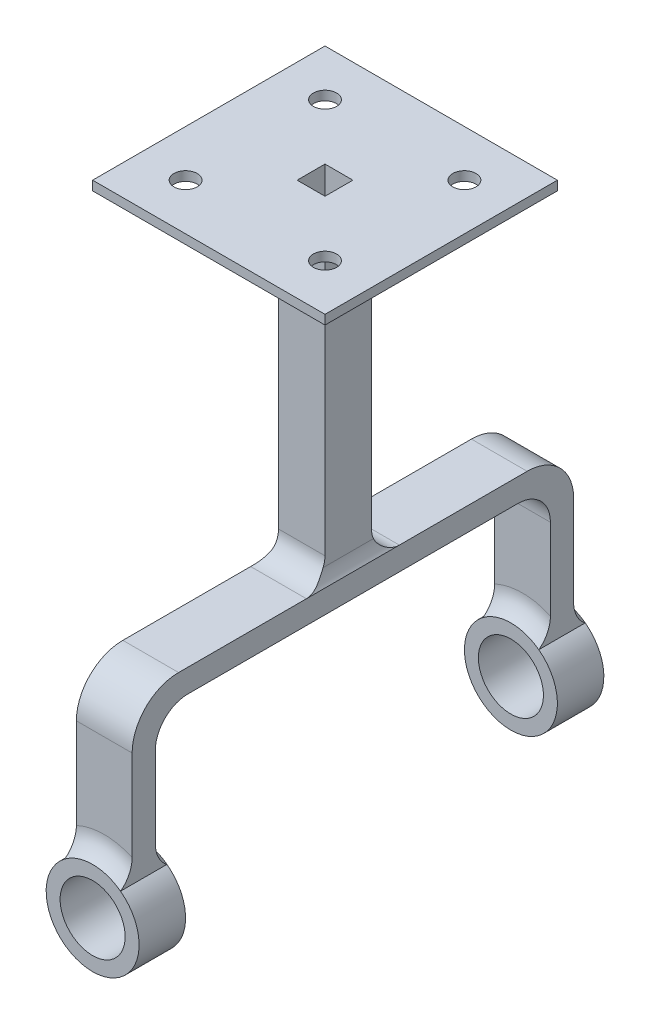
from build123d import *
from OCP.BRepFilletAPI import BRepFilletAPI_MakeFillet

# Parameters (mm, degrees)
SKETCH1_R               = 10
SKETCH1_R_2             = 7
BOSS_EXTRUDE1_DEPTH     = 100
CUT_EXTRUDE1_DEPTH      = 101.995049384
CUT_EXTRUDE1_DEPTH_BACK = 101.995049384
SKETCH2_W               = 80
SKETCH2_H               = 53.3052099
SKETCH3_W               = 12
SKETCH3_H               = 5
BOSS_EXTRUDE2_DEPTH     = 37
CUT_EXTRUDE2_DEPTH      = 105
SKETCH5_W               = 95
SKETCH5_H               = 5
BOSS_EXTRUDE3_DEPTH     = 12
FILLET1_R1              = 10
FILLET1_R2              = 7
SKETCH6_W               = 10
SKETCH6_H               = 10
SKETCH6_W_2             = 6
SKETCH6_H_2             = 6
BOSS_EXTRUDE4_DEPTH     = 70
FILLET2_R               = 5
SKETCH7_W               = 50
SKETCH7_H               = 50
SKETCH7_W_2             = 10
SKETCH7_H_2             = 10
BOSS_EXTRUDE5_DEPTH     = 2
FILLET3_R               = 3
CUT_EXTRUDE3_DEPTH      = 161.097626528


with BuildPart() as part:
    # Sketch1 → Boss-Extrude1 (new body)
    with BuildSketch(Plane.XY):
        Circle(SKETCH1_R)
        Circle(SKETCH1_R_2, mode=Mode.SUBTRACT)
    extrude(amount=BOSS_EXTRUDE1_DEPTH)

    # Sketch2 → Cut-Extrude1 (cut, two sides: drawn at the far end of the back side and taken through both)
    with BuildSketch(Plane(origin=(0, 0, 0), x_dir=(0, 0, -1), z_dir=(1, 0, 0)).offset(-CUT_EXTRUDE1_DEPTH_BACK)):
        with Locations((-50, -4.566645708)):
            Rectangle(SKETCH2_W, SKETCH2_H)
    extrude(amount=CUT_EXTRUDE1_DEPTH + CUT_EXTRUDE1_DEPTH_BACK, mode=Mode.SUBTRACT)


with BuildPart() as cut_extrude1_piece_1:
    # of the separate pieces the step leaves, piece 1, a body of its own (cut_extrude1_pieces)
    add(part.part.solids().sort_by_distance((10, 0, 0))[0])



with BuildPart() as cut_extrude1_piece_2:
    # of the separate pieces the step leaves, piece 2, a body of its own (cut_extrude1_pieces)
    add(part.part.solids().sort_by_distance((10, 0, 90))[0])


with BuildPart() as cut_extrude1_piece_1_1:
    add(cut_extrude1_piece_1.part)

    add(cut_extrude1_piece_2.part)  # Boss-Extrude2 merges Cut-Extrude1 piece 2
    # Sketch3 → Boss-Extrude2 (add)
    with BuildSketch(Plane(origin=(0, 37.5, 0), x_dir=(1, 0, 0), z_dir=(0, 1, 0))):
        with Locations((0, -95)):
            Rectangle(SKETCH3_W, SKETCH3_H)
        with Locations((0, -5)):
            Rectangle(SKETCH3_W, SKETCH3_H)
    extrude(amount=-BOSS_EXTRUDE2_DEPTH)

    # Sketch4 → Cut-Extrude2 (cut)
    with BuildSketch(Plane.XY.offset(97.5)):
        with BuildLine():
            Line((-6, 0.5), (6, 0.5))
            Line((6, 0.5), (6, 3.605551275))
            ThreePointArc((6, 3.605551275), (0, 7), (-6, 3.605551275))
            Line((-6, 3.605551275), (-6, 0.5))
        make_face()
    extrude(amount=-CUT_EXTRUDE2_DEPTH, mode=Mode.SUBTRACT)

    # Sketch5 → Boss-Extrude3 (add)
    with BuildSketch(Plane(origin=(6, 0, 0), x_dir=(0, 0, -1), z_dir=(1, 0, 0))):
        with Locations((-50, 40)):
            Rectangle(SKETCH5_W, SKETCH5_H)
    extrude(amount=-BOSS_EXTRUDE3_DEPTH)

    # Fillet1: one fillet with a radius per group of edges: ONE call of the kernel's fillet builder (fillet() takes one radius for all edges)
    fillet1_edges_1 = [cut_extrude1_piece_1_1.edges().sort_by_distance(p)[0] for p in [
        (0, 42.5, 97.5),
        (0, 42.5, 2.5),
    ]]
    fillet1_edges_2 = [cut_extrude1_piece_1_1.edges().sort_by_distance(p)[0] for p in [
        (0, 37.5, 92.5),
        (0, 37.5, 7.5),
    ]]
    fillet1 = BRepFilletAPI_MakeFillet(cut_extrude1_piece_1_1.part.solid().wrapped)
    for e in fillet1_edges_1:
        fillet1.Add(FILLET1_R1, e.wrapped)
    for e in fillet1_edges_2:
        fillet1.Add(FILLET1_R2, e.wrapped)
    add(Compound.cast(fillet1.Shape()), mode=Mode.REPLACE)

    # Sketch6 → Boss-Extrude4 (add)
    with BuildSketch(Plane(origin=(0, 42.5, 0), x_dir=(1, 0, 0), z_dir=(0, 1, 0))):
        with Locations((0, -50)):
            Rectangle(SKETCH6_W, SKETCH6_H)
        with Locations((0, -50)):
            Rectangle(SKETCH6_W_2, SKETCH6_H_2, mode=Mode.SUBTRACT)
    extrude(amount=BOSS_EXTRUDE4_DEPTH)

    # Fillet2
    # the kernel refuses this fillet: 5 mm, written as the material it adds along each edge
    with BuildSketch(Plane(origin=(0, 0, 97.5), x_dir=(-0.9879298131416905, -0.15490217656903477, 0), z_dir=(0.15490217656903477, -0.9879298131416905, 0))) as fillet2_piece_1_section:
        with BuildLine():
            CenterArc((14.330127019, -5), FILLET2_R, 90, 60)
            Line((10, -2.5), (9.91339746, -2.45))
            ThreePointArc((9.91339746, -2.45), (9.9, -1.25), (9.9, 0))
            Line((9.9, 0), (10, 0.1))
            Line((10, 0.1), (14.330127019, 0.1))
            Line((14.330127019, 0.1), (14.330127019, 0))
        make_face()
    fillet2_piece_1 = revolve(axis=Axis((0, 0, 97.5), (0, 0, -1)), revolution_arc=197.822245722, mode=Mode.PRIVATE)
    fillet2_piece_1 = split(fillet2_piece_1, bisect_by=Plane(origin=(6, 10.469703394, 98.151254793), z_dir=(-1, 0, 0)), keep=Keep.TOP, mode=Mode.PRIVATE)
    fillet2_piece_1 = split(fillet2_piece_1, bisect_by=Plane(origin=(-6, 10.469703394, 98.151254793), z_dir=(1, 0, 0)), keep=Keep.TOP, mode=Mode.PRIVATE)
    add(fillet2_piece_1)
    with BuildSketch(Plane(origin=(0, 0, 92.5), x_dir=(-0.9879298131416903, -0.15490217656903651, 0), z_dir=(0.15490217656903651, -0.9879298131416903, 0))) as fillet2_piece_2_section:
        with BuildLine():
            CenterArc((14.330127019, 5), FILLET2_R, 210, 60)
            Line((14.330127019, 0), (14.330127019, -0.1))
            Line((14.330127019, -0.1), (10, -0.1))
            Line((10, -0.1), (9.9, 0))
            ThreePointArc((9.9, 0), (9.9, 1.25), (9.91339746, 2.45))
            Line((9.91339746, 2.45), (10, 2.5))
        make_face()
    fillet2_piece_2 = revolve(axis=Axis((0, 0, 92.5), (0, 0, -1)), revolution_arc=197.822245722, mode=Mode.PRIVATE)
    fillet2_piece_2 = split(fillet2_piece_2, bisect_by=Plane(origin=(6, 10.469703394, 91.848745207), z_dir=(-1, 0, 0)), keep=Keep.TOP, mode=Mode.PRIVATE)
    fillet2_piece_2 = split(fillet2_piece_2, bisect_by=Plane(origin=(-6, 10.469703394, 91.848745207), z_dir=(1, 0, 0)), keep=Keep.TOP, mode=Mode.PRIVATE)
    add(fillet2_piece_2)
    with BuildSketch(Plane(origin=(0, 0, 2.5), x_dir=(-0.98792981314169, -0.1549021765690374, 0), z_dir=(0.1549021765690374, -0.98792981314169, 0))) as fillet2_piece_3_section:
        with BuildLine():
            CenterArc((14.330127019, 5), FILLET2_R, 210, 60)
            Line((14.330127019, 0), (14.330127019, -0.1))
            Line((14.330127019, -0.1), (10, -0.1))
            Line((10, -0.1), (9.9, 0))
            ThreePointArc((9.9, 0), (9.9, 1.25), (9.91339746, 2.45))
            Line((9.91339746, 2.45), (10, 2.5))
        make_face()
    fillet2_piece_3 = revolve(axis=Axis((0, 0, 2.5), (0, 0, -1)), revolution_arc=197.822245722, mode=Mode.PRIVATE)
    fillet2_piece_3 = split(fillet2_piece_3, bisect_by=Plane(origin=(6, 10.469703394, 1.848745207), z_dir=(-1, 0, 0)), keep=Keep.TOP, mode=Mode.PRIVATE)
    fillet2_piece_3 = split(fillet2_piece_3, bisect_by=Plane(origin=(-6, 10.469703394, 1.848745207), z_dir=(1, 0, 0)), keep=Keep.TOP, mode=Mode.PRIVATE)
    add(fillet2_piece_3)
    with BuildSketch(Plane(origin=(0, 0, 7.5), x_dir=(-0.9879298131416905, -0.15490217656903565, 0), z_dir=(0.15490217656903565, -0.9879298131416905, 0))) as fillet2_piece_4_section:
        with BuildLine():
            CenterArc((14.330127019, -5), FILLET2_R, 90, 60)
            Line((10, -2.5), (9.91339746, -2.45))
            ThreePointArc((9.91339746, -2.45), (9.9, -1.25), (9.9, 0))
            Line((9.9, 0), (10, 0.1))
            Line((10, 0.1), (14.330127019, 0.1))
            Line((14.330127019, 0.1), (14.330127019, 0))
        make_face()
    fillet2_piece_4 = revolve(axis=Axis((0, 0, 7.5), (0, 0, -1)), revolution_arc=197.822245722, mode=Mode.PRIVATE)
    fillet2_piece_4 = split(fillet2_piece_4, bisect_by=Plane(origin=(6, 10.469703394, 8.151254793), z_dir=(-1, 0, 0)), keep=Keep.TOP, mode=Mode.PRIVATE)
    fillet2_piece_4 = split(fillet2_piece_4, bisect_by=Plane(origin=(-6, 10.469703394, 8.151254793), z_dir=(1, 0, 0)), keep=Keep.TOP, mode=Mode.PRIVATE)
    add(fillet2_piece_4)
    with BuildSketch(Plane(origin=(5, 42.5, 45), x_dir=(1, 0, 0), z_dir=(0, 0, 1)), Plane(origin=(-5, 42.5, 55), x_dir=(-1, 0, 0), z_dir=(0, 0, -1))) as fillet2_piece_5:
        with BuildLine():
            CenterArc((5, 3), FILLET2_R, 180, 36.869897646)
            Line((0, 3), (-0.1, 3))
            Line((-0.1, 3), (-0.1, 0))
            Line((-0.1, 0), (0, -0.1))
            ThreePointArc((0, -0.1), (0.5, -0.1), (0.92, -0.06))
            Line((0.92, -0.06), (1, 0))
        make_face()
    extrude(amount=10)
    with BuildSketch(Plane(origin=(5, 42.5, 55), x_dir=(0, 0, 1), z_dir=(-1, 0, 0)), Plane(origin=(-5, 42.5, 45), x_dir=(0, 0, -1), z_dir=(1, 0, 0))) as fillet2_piece_6:
        with BuildLine():
            CenterArc((FILLET2_R, FILLET2_R), FILLET2_R, 180, 90)
            Line((0, FILLET2_R), (-FILLET2_R * 0.02, FILLET2_R))
            Line((-FILLET2_R * 0.02, FILLET2_R), (-FILLET2_R * 0.02, -FILLET2_R * 0.02))
            Line((-FILLET2_R * 0.02, -FILLET2_R * 0.02), (FILLET2_R, -FILLET2_R * 0.02))
            Line((FILLET2_R, -FILLET2_R * 0.02), (FILLET2_R, 0))
        make_face()
    extrude(amount=10)
    with BuildSketch(Plane(origin=(5, 42.5, 37.5), x_dir=(1, 0, 0), z_dir=(0, 0, 1))) as fillet2_piece_7a_section:
        with BuildLine():
            CenterArc((5, 3), FILLET2_R, 180, 36.869897646)
            Line((0, 3), (-0.1, 3))
            Line((-0.1, 3), (-0.1, 0))
            Line((-0.1, 0), (0, -0.1))
            ThreePointArc((0, -0.1), (0.5, -0.1), (0.92, -0.06))
            Line((0.92, -0.06), (1, 0))
        make_face()
    fillet2_piece_7a = extrude(amount=17.5, mode=Mode.PRIVATE)
    fillet2_piece_7a = split(fillet2_piece_7a, bisect_by=Plane(origin=(5.226188398, 43.349672813, 45), z_dir=(0, 0, -1)), keep=Keep.TOP, mode=Mode.PRIVATE)
    with BuildSketch(Plane(origin=(-5, 42.5, 45), x_dir=(0, 0, -1), z_dir=(1, 0, 0))) as fillet2_piece_7b_section:
        with BuildLine():
            CenterArc((FILLET2_R, FILLET2_R), FILLET2_R, 180, 90)
            Line((0, FILLET2_R), (-FILLET2_R * 0.02, FILLET2_R))
            Line((-FILLET2_R * 0.02, FILLET2_R), (-FILLET2_R * 0.02, -FILLET2_R * 0.02))
            Line((-FILLET2_R * 0.02, -FILLET2_R * 0.02), (FILLET2_R, -FILLET2_R * 0.02))
            Line((FILLET2_R, -FILLET2_R * 0.02), (FILLET2_R, 0))
        make_face()
    fillet2_piece_7b = extrude(amount=22.5, mode=Mode.PRIVATE)
    fillet2_piece_7b = split(fillet2_piece_7b, bisect_by=Plane(origin=(6, 43.631975571, 43.868024429), z_dir=(-1, 0, 0)), keep=Keep.TOP, mode=Mode.PRIVATE)
    fillet2_piece_7b = split(fillet2_piece_7b, bisect_by=Plane(origin=(5, 43.631975571, 43.868024429), z_dir=(1, 0, 0)), keep=Keep.TOP, mode=Mode.PRIVATE)
    fillet2_piece_7 = fillet2_piece_7a & fillet2_piece_7b
    add(fillet2_piece_7)
    with BuildSketch(Plane(origin=(17.5, 42.5, 55), x_dir=(0, 0, 1), z_dir=(-1, 0, 0))) as fillet2_piece_8a_section:
        with BuildLine():
            CenterArc((FILLET2_R, FILLET2_R), FILLET2_R, 180, 90)
            Line((0, FILLET2_R), (-FILLET2_R * 0.02, FILLET2_R))
            Line((-FILLET2_R * 0.02, FILLET2_R), (-FILLET2_R * 0.02, -FILLET2_R * 0.02))
            Line((-FILLET2_R * 0.02, -FILLET2_R * 0.02), (FILLET2_R, -FILLET2_R * 0.02))
            Line((FILLET2_R, -FILLET2_R * 0.02), (FILLET2_R, 0))
        make_face()
    fillet2_piece_8a = extrude(amount=22.5, mode=Mode.PRIVATE)
    fillet2_piece_8a = split(fillet2_piece_8a, bisect_by=Plane(origin=(6, 43.631975571, 56.131975571), z_dir=(-1, 0, 0)), keep=Keep.TOP, mode=Mode.PRIVATE)
    fillet2_piece_8a = split(fillet2_piece_8a, bisect_by=Plane(origin=(5, 43.631975571, 56.131975571), z_dir=(1, 0, 0)), keep=Keep.TOP, mode=Mode.PRIVATE)
    with BuildSketch(Plane(origin=(5, 42.5, 45), x_dir=(1, 0, 0), z_dir=(0, 0, 1))) as fillet2_piece_8b_section:
        with BuildLine():
            CenterArc((5, 3), FILLET2_R, 180, 36.869897646)
            Line((0, 3), (-0.1, 3))
            Line((-0.1, 3), (-0.1, 0))
            Line((-0.1, 0), (0, -0.1))
            ThreePointArc((0, -0.1), (0.5, -0.1), (0.92, -0.06))
            Line((0.92, -0.06), (1, 0))
        make_face()
    fillet2_piece_8b = extrude(amount=17.5, mode=Mode.PRIVATE)
    fillet2_piece_8b = split(fillet2_piece_8b, bisect_by=Plane(origin=(5.226188398, 43.349672813, 55), z_dir=(0, 0, 1)), keep=Keep.TOP, mode=Mode.PRIVATE)
    fillet2_piece_8 = fillet2_piece_8a & fillet2_piece_8b
    add(fillet2_piece_8)
    with BuildSketch(Plane(origin=(-5, 42.5, 62.5), x_dir=(-1, 0, 0), z_dir=(0, 0, -1))) as fillet2_piece_9a_section:
        with BuildLine():
            CenterArc((5, 3), FILLET2_R, 180, 36.869897646)
            Line((0, 3), (-0.1, 3))
            Line((-0.1, 3), (-0.1, 0))
            Line((-0.1, 0), (0, -0.1))
            ThreePointArc((0, -0.1), (0.5, -0.1), (0.92, -0.06))
            Line((0.92, -0.06), (1, 0))
        make_face()
    fillet2_piece_9a = extrude(amount=17.5, mode=Mode.PRIVATE)
    fillet2_piece_9a = split(fillet2_piece_9a, bisect_by=Plane(origin=(-5.226188398, 43.349672813, 55), z_dir=(0, 0, 1)), keep=Keep.TOP, mode=Mode.PRIVATE)
    with BuildSketch(Plane(origin=(5, 42.5, 55), x_dir=(0, 0, 1), z_dir=(-1, 0, 0))) as fillet2_piece_9b_section:
        with BuildLine():
            CenterArc((FILLET2_R, FILLET2_R), FILLET2_R, 180, 90)
            Line((0, FILLET2_R), (-FILLET2_R * 0.02, FILLET2_R))
            Line((-FILLET2_R * 0.02, FILLET2_R), (-FILLET2_R * 0.02, -FILLET2_R * 0.02))
            Line((-FILLET2_R * 0.02, -FILLET2_R * 0.02), (FILLET2_R, -FILLET2_R * 0.02))
            Line((FILLET2_R, -FILLET2_R * 0.02), (FILLET2_R, 0))
        make_face()
    fillet2_piece_9b = extrude(amount=22.5, mode=Mode.PRIVATE)
    fillet2_piece_9b = split(fillet2_piece_9b, bisect_by=Plane(origin=(-6, 43.631975571, 56.131975571), z_dir=(1, 0, 0)), keep=Keep.TOP, mode=Mode.PRIVATE)
    fillet2_piece_9b = split(fillet2_piece_9b, bisect_by=Plane(origin=(-5, 43.631975571, 56.131975571), z_dir=(-1, 0, 0)), keep=Keep.TOP, mode=Mode.PRIVATE)
    fillet2_piece_9 = fillet2_piece_9a & fillet2_piece_9b
    add(fillet2_piece_9)
    with BuildSketch(Plane(origin=(-5, 42.5, 55), x_dir=(-1, 0, 0), z_dir=(0, 0, -1))) as fillet2_piece_10a_section:
        with BuildLine():
            CenterArc((5, 3), FILLET2_R, 180, 36.869897646)
            Line((0, 3), (-0.1, 3))
            Line((-0.1, 3), (-0.1, 0))
            Line((-0.1, 0), (0, -0.1))
            ThreePointArc((0, -0.1), (0.5, -0.1), (0.92, -0.06))
            Line((0.92, -0.06), (1, 0))
        make_face()
    fillet2_piece_10a = extrude(amount=17.5, mode=Mode.PRIVATE)
    fillet2_piece_10a = split(fillet2_piece_10a, bisect_by=Plane(origin=(-5.226188398, 43.349672813, 45), z_dir=(0, 0, -1)), keep=Keep.TOP, mode=Mode.PRIVATE)
    with BuildSketch(Plane(origin=(-17.5, 42.5, 45), x_dir=(0, 0, -1), z_dir=(1, 0, 0))) as fillet2_piece_10b_section:
        with BuildLine():
            CenterArc((FILLET2_R, FILLET2_R), FILLET2_R, 180, 90)
            Line((0, FILLET2_R), (-FILLET2_R * 0.02, FILLET2_R))
            Line((-FILLET2_R * 0.02, FILLET2_R), (-FILLET2_R * 0.02, -FILLET2_R * 0.02))
            Line((-FILLET2_R * 0.02, -FILLET2_R * 0.02), (FILLET2_R, -FILLET2_R * 0.02))
            Line((FILLET2_R, -FILLET2_R * 0.02), (FILLET2_R, 0))
        make_face()
    fillet2_piece_10b = extrude(amount=22.5, mode=Mode.PRIVATE)
    fillet2_piece_10b = split(fillet2_piece_10b, bisect_by=Plane(origin=(-6, 43.631975571, 43.868024429), z_dir=(1, 0, 0)), keep=Keep.TOP, mode=Mode.PRIVATE)
    fillet2_piece_10b = split(fillet2_piece_10b, bisect_by=Plane(origin=(-5, 43.631975571, 43.868024429), z_dir=(-1, 0, 0)), keep=Keep.TOP, mode=Mode.PRIVATE)
    fillet2_piece_10 = fillet2_piece_10a & fillet2_piece_10b
    add(fillet2_piece_10)

    # Sketch7 → Boss-Extrude5 (add)
    with BuildSketch(Plane(origin=(0, 112.5, 0), x_dir=(1, 0, 0), z_dir=(0, 1, 0))):
        with Locations((0, -50)):
            Rectangle(SKETCH7_W, SKETCH7_H)
        with Locations((0, -50)):
            Rectangle(SKETCH7_W_2, SKETCH7_H_2, mode=Mode.SUBTRACT)
    extrude(amount=-BOSS_EXTRUDE5_DEPTH)

    # Fillet3
    fillet3_edges = [cut_extrude1_piece_1_1.edges().sort_by_distance(p)[0] for p in [
        (5, 110.5, 50),
        (0, 110.5, 45),
        (-5, 110.5, 50),
        (0, 110.5, 55),
    ]]
    fillet(fillet3_edges, radius=FILLET3_R)

    # Sketch8 → Cut-Extrude3 (cut, through all)
    with BuildSketch(Plane(origin=(0, 112.5, 0), x_dir=(1, 0, 0), z_dir=(0, 1, 0))):
        with BuildLine():
            ThreePointArc((17.5, -65), (16.767766953, -63.232233047), (15, -62.5))
            Line((15, -62.5), (15, -65))
            Line((15, -65), (12.5, -65))
            ThreePointArc((12.5, -65), (15, -67.5), (17.5, -65))
        make_face()
        with BuildLine():
            Line((15, -65), (15, -62.5))
            ThreePointArc((15, -62.5), (13.232233047, -63.232233047), (12.5, -65))
            Line((12.5, -65), (15, -65))
        make_face()
        with BuildLine():
            ThreePointArc((17.5, -35), (15, -32.5), (12.5, -35))
            Line((12.5, -35), (15, -35))
            Line((15, -35), (15, -37.5))
            ThreePointArc((15, -37.5), (16.767766953, -36.767766953), (17.5, -35))
        make_face()
        with BuildLine():
            Line((15, -35), (12.5, -35))
            ThreePointArc((12.5, -35), (13.232233047, -36.767766953), (15, -37.5))
            Line((15, -37.5), (15, -35))
        make_face()
        with BuildLine():
            ThreePointArc((-15, -37.5), (-13.232233047, -36.767766953), (-12.5, -35))
            Line((-12.5, -35), (-15, -35))
            Line((-15, -35), (-15, -37.5))
        make_face()
        with BuildLine():
            Line((-15, -35), (-12.5, -35))
            ThreePointArc((-12.5, -35), (-16.767766953, -33.232233047), (-15, -37.5))
            Line((-15, -37.5), (-15, -35))
        make_face()
        with BuildLine():
            ThreePointArc((-12.5, -65), (-13.232233047, -63.232233047), (-15, -62.5))
            Line((-15, -62.5), (-15, -65))
            Line((-15, -65), (-12.5, -65))
        make_face()
        with BuildLine():
            Line((-15, -65), (-15, -62.5))
            ThreePointArc((-15, -62.5), (-16.767766953, -66.767766953), (-12.5, -65))
            Line((-12.5, -65), (-15, -65))
        make_face()
    extrude(amount=-CUT_EXTRUDE3_DEPTH, mode=Mode.SUBTRACT)


solid = cut_extrude1_piece_1_1.part
